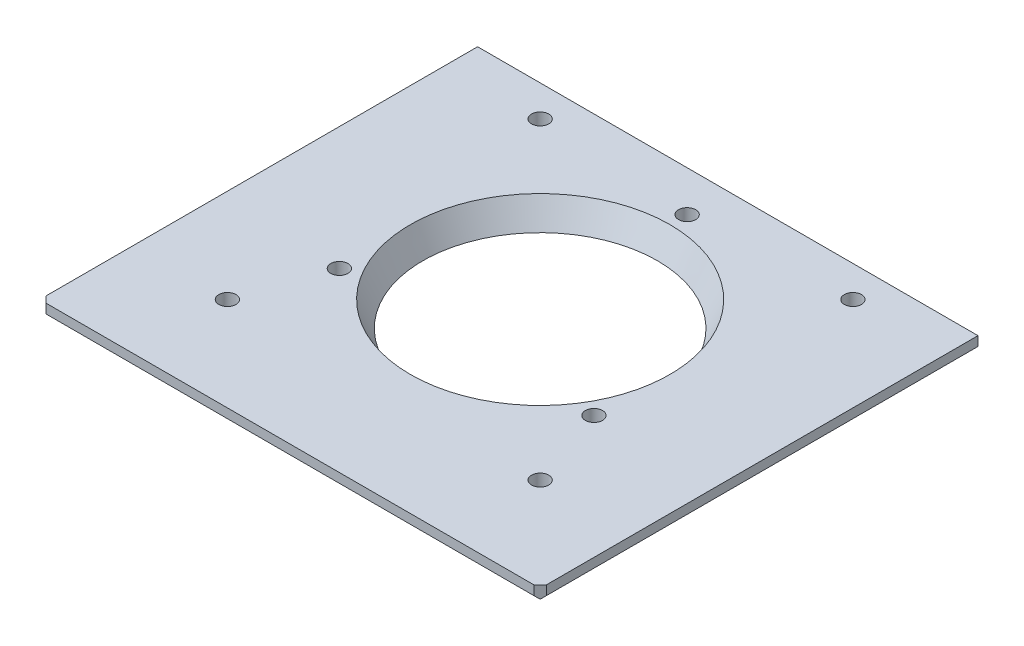
from build123d import *

# Parameters (mm, degrees)
SKETCH1_R           = 18.75
SKETCH1_W           = 80
SKETCH1_H           = 10
BOSS_EXTRUDE2_DEPTH = 4
CHAMFER2_SIZE2      = 4
CHAMFER2_SIZE       = 2
SKETCH1_3_R         = 1.375
BOSS_EXTRUDE3_DEPTH = 1
CHAMFER3_SIZE       = 0.5
CHAMFER4_SIZE       = 1
CHAMFER5_SIZE       = 2.5


# Some blends are built 0.0001 mm under size
with BuildPart() as part:
    # Sketch1 → Boss-Extrude2 (new body)
    # profile 1 of 2: a face of its own
    with BuildSketch(Plane(origin=(0, 0, 0), x_dir=(1, 0, 0), z_dir=(0, 1, 0))):
        Polygon((-25, 30), (-40, 30), (-40, -30), (40, -30), (40, 30), (25, 30), align=None)
        with BuildLine():
            ThreePointArc((-23.625, -25), (-25.972271824, -25.972271824), (-25, -23.625))
            ThreePointArc((-25, -23.625), (-24.027728176, -24.027728176), (-23.625, -25))
        make_face(mode=Mode.SUBTRACT)
        with BuildLine():
            ThreePointArc((-19.629554465, -12.920162208), (-21.542381919, -12.4375), (-21.003965926, -10.539611728))
            ThreePointArc((-21.003965926, -10.539611728), (-19.646750299, -10.569400091), (-18.976596989, -11.75))
            ThreePointArc((-18.976596989, -11.75), (-19.150881896, -12.420006168), (-19.629554465, -12.920162208))
        make_face(mode=Mode.SUBTRACT)
        with BuildLine():
            ThreePointArc((26.375, -25), (24.027728176, -25.972271824), (25, -23.625))
            ThreePointArc((25, -23.625), (25.972271824, -24.027728176), (26.375, -25))
        make_face(mode=Mode.SUBTRACT)
        with BuildLine():
            ThreePointArc((21.726596989, -11.75), (21.021603157, -12.950715093), (19.629554465, -12.920162208))
            ThreePointArc((19.629554465, -12.920162208), (19.681590821, -10.549284907), (21.726596989, -11.75))
        make_face(mode=Mode.SUBTRACT)
        with BuildLine():
            ThreePointArc((-25, 23.625), (-26.375, 25), (-25, 26.375))
            ThreePointArc((-25, 26.375), (-24.027728176, 25.972271824), (-23.625, 25))
            ThreePointArc((-23.625, 25), (-24.027728176, 24.027728176), (-25, 23.625))
        make_face(mode=Mode.SUBTRACT)
        with Locations(Location((0, 0, 0), (0, 0, 270))):
            Circle(SKETCH1_R, mode=Mode.SUBTRACT)
        with BuildLine():
            ThreePointArc((1.375, 23.5), (0.020115184, 22.125147143), (-1.374411461, 23.459773936))
            ThreePointArc((-1.374411461, 23.459773936), (-0.020115184, 24.874852857), (1.375, 23.5))
        make_face(mode=Mode.SUBTRACT)
        with BuildLine():
            ThreePointArc((25, 23.625), (23.625, 25), (25, 26.375))
            ThreePointArc((25, 26.375), (25.972271824, 25.972271824), (26.375, 25))
            ThreePointArc((26.375, 25), (25.972271824, 24.027728176), (25, 23.625))
        make_face(mode=Mode.SUBTRACT)
    # profile 2 of 2: a face of its own
    with BuildSketch(Plane(origin=(0, 0, 0), x_dir=(1, 0, 0), z_dir=(0, 1, 0))):
        with Locations((0, -35)):
            Rectangle(SKETCH1_W, SKETCH1_H)
    extrude(amount=BOSS_EXTRUDE2_DEPTH)

    # Chamfer2
    chamfer2_edges = [part.edges().sort_by_distance(p)[0] for p in [
        (0, 4, -18.75),
    ]]
    chamfer2_side = [part.faces().sort_by_distance(p)[0] for p in [
        (0, 4, -18.79),
    ]]
    chamfer(chamfer2_edges, length=CHAMFER2_SIZE - 0.0001, length2=CHAMFER2_SIZE2 - 0.0001, reference=chamfer2_side[0])  # a hair under: the kernel refuses the full size

    # Sketch1<3> → Boss-Extrude3 (add)
    with BuildSketch(Plane(origin=(0, 0, 0), x_dir=(1, 0, 0), z_dir=(0, 1, 0))):
        with Locations(Location((0, 23.5, 0), (0, 0, 270))):
            Circle(SKETCH1_3_R)
        with Locations(Location((20.351596989, -11.75, 0), (0, 0, 270))):
            Circle(SKETCH1_3_R)
        with Locations(Location((-20.351596989, -11.75, 0), (0, 0, 270))):
            Circle(SKETCH1_3_R)
    extrude(amount=BOSS_EXTRUDE3_DEPTH)

    # Chamfer3
    chamfer3_edges = [part.edges().sort_by_distance(p)[0] for p in [
        (-25, 0, 26.375),
        (-26.375, 0, -25),
        (23.625, 0, -25),
        (25, 0, 26.375),
    ]]
    chamfer(chamfer3_edges, length=CHAMFER3_SIZE)

    # Chamfer4
    chamfer4_edges = [part.edges().sort_by_distance(p)[0] for p in [
        (40, 2, 40),
        (-40, 2, 40),
    ]]
    chamfer(chamfer4_edges, length=CHAMFER4_SIZE)

    # Chamfer5
    # the kernel refuses this chamfer: 2.5 mm, written as the material it takes off along each edge
    with BuildSketch(Plane(origin=(40, 0, -36.42920747), x_dir=(0.0274958766105877, 0.9996219169112968, 0), z_dir=(0, 0, 1))) as chamfer5_piece_1:
        Polygon((CHAMFER5_SIZE * 0.999621916911, CHAMFER5_SIZE * 0.0274958766106), (-CHAMFER5_SIZE * 0.0274958766106, CHAMFER5_SIZE * 0.999621916911), (0, 0), align=None)
    extrude(amount=81.85841494, mode=Mode.SUBTRACT)
    with BuildSketch(Plane(origin=(-45.42920747, 0, 40), x_dir=(0, 0.9996219169112968, 0.0274958766105877), z_dir=(1, 0, 0))) as chamfer5_piece_2:
        Polygon((CHAMFER5_SIZE * 0.999621916911, -CHAMFER5_SIZE * 0.0274958766106), (-CHAMFER5_SIZE * 0.0274958766106, -CHAMFER5_SIZE * 0.999621916911), (0, 0), align=None)
    extrude(amount=90.85841494, mode=Mode.SUBTRACT)
    with BuildSketch(Plane(origin=(-40, 0, -36.42920747), x_dir=(-0.0274958766105877, 0.9996219169112968, 0), z_dir=(0, 0, 1))) as chamfer5_piece_3:
        Polygon((CHAMFER5_SIZE * 0.999621916911, -CHAMFER5_SIZE * 0.0274958766106), (-CHAMFER5_SIZE * 0.0274958766106, -CHAMFER5_SIZE * 0.999621916911), (0, 0), align=None)
    extrude(amount=81.85841494, mode=Mode.SUBTRACT)


solid = part.part
